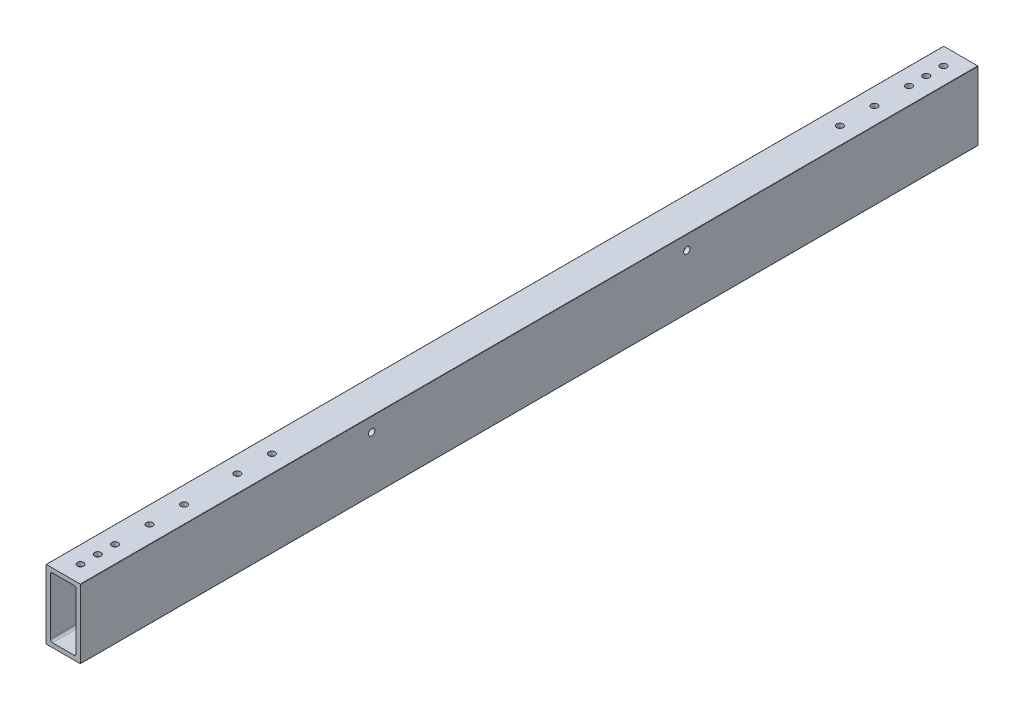
from build123d import *

# Parameters (mm, degrees)
CUT_EXTRUDE1_START = -1828.8
CUT_EXTRUDE1_DEPTH = 660.4
SKETCH3_R          = 2.38125
CUT_EXTRUDE3_DEPTH = 50.8
CUT_EXTRUDE4_REACH = 664.838
SKETCH4_R          = 2.413
CUT_EXTRUDE5_REACH = 664.838
SKETCH5_R          = 2.85115
SKETCH6_R          = 2.38125
CUT_EXTRUDE6_DEPTH = 663.837808315


with BuildPart() as part:
    # Cut-Extrude1: read off the stored shape, not the designer's step
    # Cut-Extrude1 outline → Cut-Extrude1 (new body)
    with BuildSketch(Plane.XY.offset(1828.8).offset(CUT_EXTRUDE1_START)):
        with BuildLine():
            Line((0, 50.546), (0, 0.254))
            ThreePointArc((0, 0.254), (0.074394878, 0.074394878), (0.254, 0))
            Line((0.254, 0), (25.146, 0))
            ThreePointArc((25.146, 0), (25.325605122, 0.074394878), (25.4, 0.254))
            Line((25.4, 0.254), (25.4, 50.546))
            ThreePointArc((25.4, 50.546), (25.325605122, 50.725605122), (25.146, 50.8))
            Line((25.146, 50.8), (0.254, 50.8))
            ThreePointArc((0.254, 50.8), (0.074394878, 50.725605122), (0, 50.546))
        make_face()
        with BuildLine():
            ThreePointArc((4.7625, 3.175), (3.639967985, 3.639967985), (3.175, 4.7625))
            Line((3.175, 4.7625), (3.175, 46.0375))
            ThreePointArc((3.175, 46.0375), (3.639967985, 47.160032015), (4.7625, 47.625))
            Line((4.7625, 47.625), (20.6375, 47.625))
            ThreePointArc((20.6375, 47.625), (21.760032015, 47.160032015), (22.225, 46.0375))
            Line((22.225, 46.0375), (22.225, 4.7625))
            ThreePointArc((22.225, 4.7625), (21.760032015, 3.639967985), (20.6375, 3.175))
            Line((20.6375, 3.175), (4.7625, 3.175))
        make_face(mode=Mode.SUBTRACT)
    extrude(amount=CUT_EXTRUDE1_DEPTH)

    # Sketch3 → Cut-Extrude3 (cut)
    with BuildSketch(Plane(origin=(0, 50.8, 0), x_dir=(1, 0, 0), z_dir=(0, 1, 0))):
        with Locations(Location((12.7, -25.4, 0), (0, 0, 270))):
            Circle(SKETCH3_R)
        with Locations(Location((12.7, -12.7, 0), (0, 0, 270))):
            Circle(SKETCH3_R)
        with Locations(Location((12.7, -38.1, 0), (0, 0, 270))):
            Circle(SKETCH3_R)
        with Locations(Location((12.7, -622.3, 0), (0, 0, 270))):
            Circle(SKETCH3_R)
        with Locations(Location((12.7, -635, 0), (0, 0, 270))):
            Circle(SKETCH3_R)
        with Locations(Location((12.7, -647.7, 0), (0, 0, 270))):
            Circle(SKETCH3_R)
        with Locations(Location((12.7, -63.5, 0), (0, 0, 270))):
            Circle(SKETCH3_R)
        with Locations(Location((12.7, -88.9, 0), (0, 0, 270))):
            Circle(SKETCH3_R)
        with Locations(Location((12.7, -596.9, 0), (0, 0, 270))):
            Circle(SKETCH3_R)
        with Locations(Location((12.7, -571.5, 0), (0, 0, 270))):
            Circle(SKETCH3_R)
    extrude(amount=-CUT_EXTRUDE3_DEPTH, mode=Mode.SUBTRACT)

    # Sketch4 → Cut-Extrude4 (cut, up to next)
    with BuildSketch(Plane(origin=(0, 50.8, 0), x_dir=(1, 0, 0), z_dir=(0, 1, 0)), mode=Mode.PRIVATE) as cut_extrude4_sk1:
        with Locations(Location((12.7, -532.289940881, 0), (0, 0, 270))):
            Circle(SKETCH4_R)
    cut_extrude4_tool1 = extrude(cut_extrude4_sk1.sketch, amount=-CUT_EXTRUDE4_REACH, mode=Mode.PRIVATE) & part.part
    # Sketch4 → Cut-Extrude4 (cut, up to next)
    with BuildSketch(Plane(origin=(0, 50.8, 0), x_dir=(1, 0, 0), z_dir=(0, 1, 0)), mode=Mode.PRIVATE) as cut_extrude4_sk2:
        with Locations(Location((12.7, -506.889940881, 0), (0, 0, 270))):
            Circle(SKETCH4_R)
    cut_extrude4_tool2 = extrude(cut_extrude4_sk2.sketch, amount=-CUT_EXTRUDE4_REACH, mode=Mode.PRIVATE) & part.part
    add(cut_extrude4_tool1.solids().sort_by_distance((12.7, 50.8, 532.289941))[0], mode=Mode.SUBTRACT)
    add(cut_extrude4_tool2.solids().sort_by_distance((12.7, 50.8, 506.889941))[0], mode=Mode.SUBTRACT)

    # Sketch5 → Cut-Extrude5 (cut, up to next)
    with BuildSketch(Plane.ZY, mode=Mode.PRIVATE) as cut_extrude5_sk1:
        with Locations((197.92315, 31.33725)):
            Circle(SKETCH5_R)
    cut_extrude5_tool1 = extrude(cut_extrude5_sk1.sketch, amount=-CUT_EXTRUDE5_REACH, mode=Mode.PRIVATE) & part.part
    # Sketch5 → Cut-Extrude5 (cut, up to next)
    with BuildSketch(Plane.ZY, mode=Mode.PRIVATE) as cut_extrude5_sk2:
        with Locations((230.57485, 31.33725)):
            Circle(SKETCH5_R)
    cut_extrude5_tool2 = extrude(cut_extrude5_sk2.sketch, amount=-CUT_EXTRUDE5_REACH, mode=Mode.PRIVATE) & part.part
    # Sketch5 → Cut-Extrude5 (cut, up to next)
    with BuildSketch(Plane.ZY, mode=Mode.PRIVATE) as cut_extrude5_sk3:
        with Locations((230.57485, 6.76275)):
            Circle(SKETCH5_R)
    cut_extrude5_tool3 = extrude(cut_extrude5_sk3.sketch, amount=-CUT_EXTRUDE5_REACH, mode=Mode.PRIVATE) & part.part
    # Sketch5 → Cut-Extrude5 (cut, up to next)
    with BuildSketch(Plane.ZY, mode=Mode.PRIVATE) as cut_extrude5_sk4:
        with Locations((197.92315, 6.76275)):
            Circle(SKETCH5_R)
    cut_extrude5_tool4 = extrude(cut_extrude5_sk4.sketch, amount=-CUT_EXTRUDE5_REACH, mode=Mode.PRIVATE) & part.part
    # Sketch5 → Cut-Extrude5 (cut, up to next)
    with BuildSketch(Plane.ZY, mode=Mode.PRIVATE) as cut_extrude5_sk5:
        with Locations((429.82515, 31.33725)):
            Circle(SKETCH5_R)
    cut_extrude5_tool5 = extrude(cut_extrude5_sk5.sketch, amount=-CUT_EXTRUDE5_REACH, mode=Mode.PRIVATE) & part.part
    # Sketch5 → Cut-Extrude5 (cut, up to next)
    with BuildSketch(Plane.ZY, mode=Mode.PRIVATE) as cut_extrude5_sk6:
        with Locations((462.47685, 31.33725)):
            Circle(SKETCH5_R)
    cut_extrude5_tool6 = extrude(cut_extrude5_sk6.sketch, amount=-CUT_EXTRUDE5_REACH, mode=Mode.PRIVATE) & part.part
    # Sketch5 → Cut-Extrude5 (cut, up to next)
    with BuildSketch(Plane.ZY, mode=Mode.PRIVATE) as cut_extrude5_sk7:
        with Locations((462.47685, 6.76275)):
            Circle(SKETCH5_R)
    cut_extrude5_tool7 = extrude(cut_extrude5_sk7.sketch, amount=-CUT_EXTRUDE5_REACH, mode=Mode.PRIVATE) & part.part
    # Sketch5 → Cut-Extrude5 (cut, up to next)
    with BuildSketch(Plane.ZY, mode=Mode.PRIVATE) as cut_extrude5_sk8:
        with Locations((429.82515, 6.76275)):
            Circle(SKETCH5_R)
    cut_extrude5_tool8 = extrude(cut_extrude5_sk8.sketch, amount=-CUT_EXTRUDE5_REACH, mode=Mode.PRIVATE) & part.part
    add(cut_extrude5_tool1.solids().sort_by_distance((0, 31.33725, 197.92315))[0], mode=Mode.SUBTRACT)
    add(cut_extrude5_tool2.solids().sort_by_distance((0, 31.33725, 230.57485))[0], mode=Mode.SUBTRACT)
    add(cut_extrude5_tool3.solids().sort_by_distance((0, 6.76275, 230.57485))[0], mode=Mode.SUBTRACT)
    add(cut_extrude5_tool4.solids().sort_by_distance((0, 6.76275, 197.92315))[0], mode=Mode.SUBTRACT)
    add(cut_extrude5_tool5.solids().sort_by_distance((0, 31.33725, 429.82515))[0], mode=Mode.SUBTRACT)
    add(cut_extrude5_tool6.solids().sort_by_distance((0, 31.33725, 462.47685))[0], mode=Mode.SUBTRACT)
    add(cut_extrude5_tool7.solids().sort_by_distance((0, 6.76275, 462.47685))[0], mode=Mode.SUBTRACT)
    add(cut_extrude5_tool8.solids().sort_by_distance((0, 6.76275, 429.82515))[0], mode=Mode.SUBTRACT)

    # Sketch6 → Cut-Extrude6 (cut, through all)
    with BuildSketch(Plane.ZY):
        with Locations((214.249, 40.48125)):
            Circle(SKETCH6_R)
        with Locations((446.151, 40.48125)):
            Circle(SKETCH6_R)
    extrude(amount=-CUT_EXTRUDE6_DEPTH, mode=Mode.SUBTRACT)


solid = part.part
